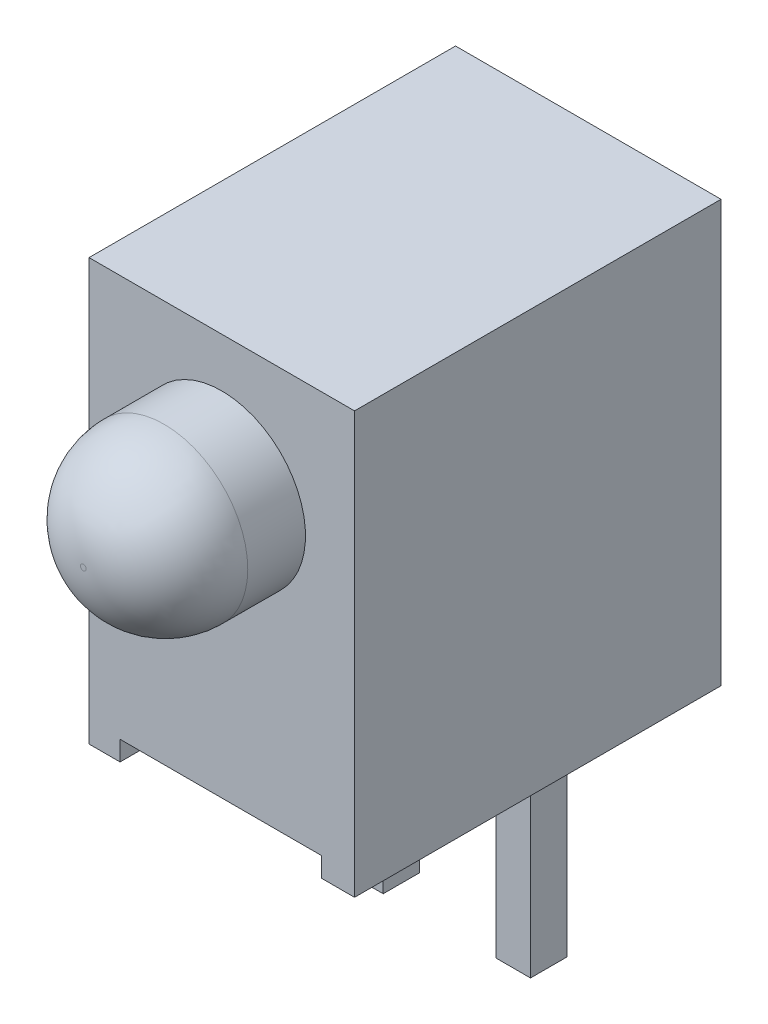
from build123d import *

# Parameters (mm, degrees)
SKETCH1_W           = 4.6
SKETCH1_H           = 6.35
BOSS_EXTRUDE1_DEPTH = 7.3
SKETCH2_R           = 1.45
BOSS_EXTRUDE2_DEPTH = 2.4
FILLET2_R           = 1.4
SKETCH4_W           = 3.493828458
SKETCH4_H           = 0.340679683
CUT_EXTRUDE1_DEPTH  = 10.944973605
SKETCH6_W           = 0.6
SKETCH6_H           = 0.632779056
BOSS_EXTRUDE5_DEPTH = 3.81


with BuildPart() as part:
    # Sketch1 → Boss-Extrude1 (new body)
    with BuildSketch(Plane(origin=(0, 0, 0), x_dir=(1, 0, 0), z_dir=(0, 1, 0))):
        Rectangle(SKETCH1_W, SKETCH1_H)
    extrude(amount=BOSS_EXTRUDE1_DEPTH)

    # Sketch2 → Boss-Extrude2 (add)
    with BuildSketch(Plane.XY.offset(3.175)):
        with Locations((0, 5)):
            Circle(SKETCH2_R)
    extrude(amount=BOSS_EXTRUDE2_DEPTH)

    # Fillet2
    fillet2_edges = [part.edges().sort_by_distance(p)[0] for p in [
        (-1.45, 5, 5.575),
    ]]
    fillet(fillet2_edges, radius=FILLET2_R)

    # Sketch4 → Cut-Extrude1 (cut, through all)
    with BuildSketch(Plane.XY.offset(3.175)):
        with Locations((-0.015737966, 0.170339842)):
            Rectangle(SKETCH4_W, SKETCH4_H)
    extrude(amount=-CUT_EXTRUDE1_DEPTH, mode=Mode.SUBTRACT)

    # Sketch6 → Boss-Extrude5 (add)
    with BuildSketch(Plane.XZ.offset(-0.340679683)):
        with Locations((-1.274553872, -0.912409627)):
            Rectangle(SKETCH6_W, SKETCH6_H)
        with Locations((1.265446128, -0.925)):
            Rectangle(SKETCH6_W, SKETCH6_H)
    extrude(amount=BOSS_EXTRUDE5_DEPTH)


solid = part.part
